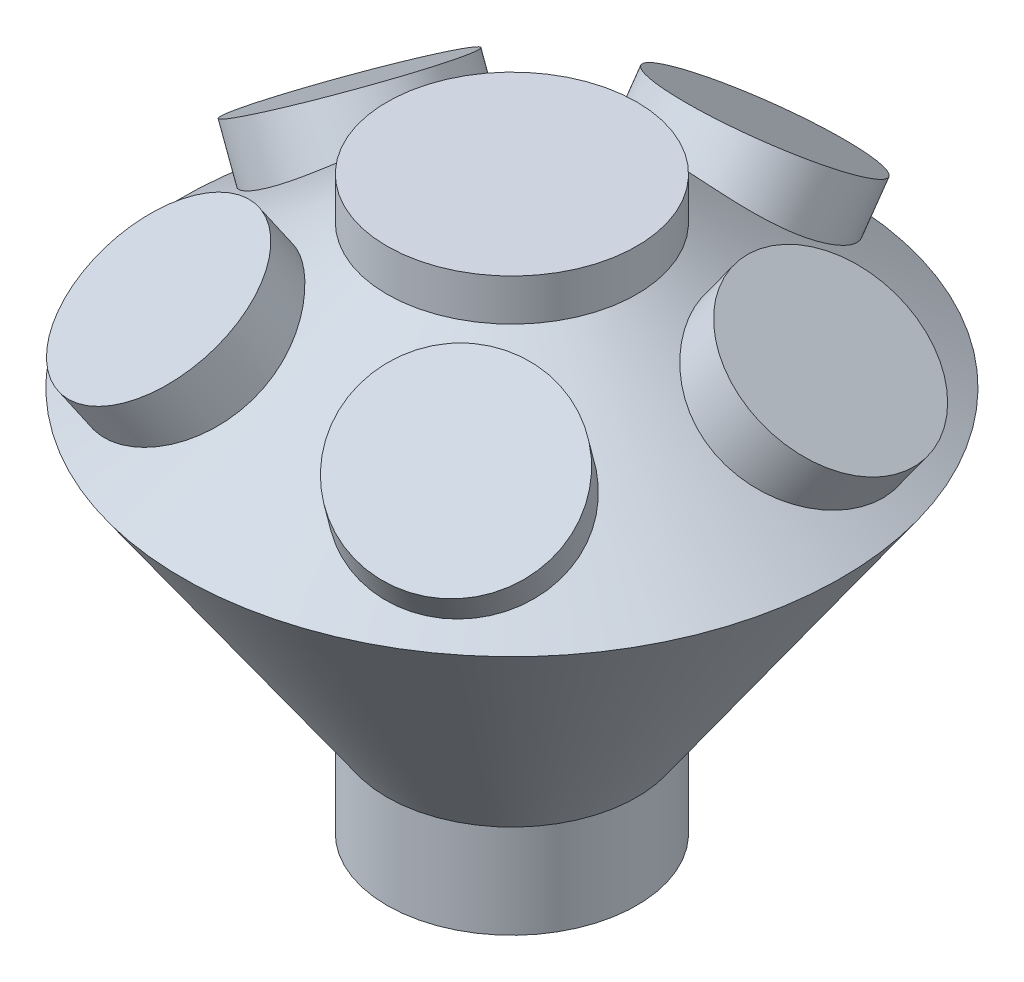
from build123d import *

# Parameters (mm, degrees)
F_7_16_0_4375_DIAMETER_HOLE1_D         = 11.1125
F_7_16_START                           = 1.779676233
F_7_16_0_4375_DIAMETER_HOLE2_OUTLINE_R = 5.55625
F_7_16_0_4375_DIAMETER_HOLE2_DEPTH     = 24.355951698
CIRPATTERN1_COUNT                      = 5
SKETCH11_R                             = 7.62
BOSS_EXTRUDE1_DEPTH                    = 2.54
BOSS_EXTRUDE2_START                    = 2.54
SKETCH12_R                             = 7.62
BOSS_EXTRUDE2_DEPTH                    = 2.54
BOSS_EXTRUDE3_REACH                    = 52.922
SKETCH13_R                             = 5.87375
SKETCH13_R_2                           = 5.55625
CUT_EXTRUDE1_START                     = -3.182233
SKETCH14_R                             = 5.55625
CUT_EXTRUDE1_DEPTH                     = 0.642233
CIRPATTERN3_COUNT                      = 5


# Read off the part's stored shape, not the designer's step: 7/16 (0.4375) Diameter Hole2
with BuildPart() as part:
    # Sketch1 → Revolve1 (revolve)
    with BuildSketch(Plane.XY, mode=Mode.PRIVATE) as revolve1_sk:
        Polygon((0, 0), (0, 26.570129165), (7.62, 26.570129165), (20.103877155, 17.828824275), (7.62, 0), (7.62, -3.175), (0, -3.175), align=None)
    revolve(revolve1_sk.sketch.rotate(Axis((0, 0, 0), (0, 1, 0)), 90), axis=Axis((0, 0, 0), (0, 1, 0)))

    # 7/16 (0.4375) Diameter Hole1 (through all)
    with Locations(Plane(origin=(0, 26.570129165, 0), x_dir=(1, 0, 0), z_dir=(0, 1, 0))):
        with Locations((0, 0)):
            Hole(F_7_16_0_4375_DIAMETER_HOLE1_D / 2)

    # 7/16 (0.4375) Diameter Hole2 outline → 7/16 (0.4375) Diameter Hole2 (cut)
    with BuildSketch(Plane(origin=(0, 0, 0), x_dir=(1, 0, 0), z_dir=(0, 0.8191520442889911, -0.5735764363510472)).offset(F_7_16_START)):
        with Locations((0, -1.246142784)):
            Circle(F_7_16_0_4375_DIAMETER_HOLE2_OUTLINE_R)
    f_7_16_0_4375_diameter_hole2 = extrude(amount=F_7_16_0_4375_DIAMETER_HOLE2_DEPTH, mode=Mode.SUBTRACT)

    # CirPattern1: 7/16 (0.4375) Diameter Hole2 ×5 about axis
    cirpattern1_axis = Axis((0, 26.570129165, 0), (0, 1, 0))
    for i in range(1, CIRPATTERN1_COUNT):
        add(f_7_16_0_4375_diameter_hole2.rotate(cirpattern1_axis, i * 360 / CIRPATTERN1_COUNT), mode=Mode.SUBTRACT)

    # Sketch11 → Boss-Extrude1 (add)
    with BuildSketch(Plane(origin=(0, 26.570129165, 0), x_dir=(1, 0, 0), z_dir=(0, 1, 0))):
        with Locations(Location((0, 0, 0), (0, 0, 90))):
            Circle(SKETCH11_R)
    extrude(amount=BOSS_EXTRUDE1_DEPTH)

    # Sketch12 → Boss-Extrude2 (add)
    with BuildSketch(Plane.XZ.offset(3.175).offset(BOSS_EXTRUDE2_START)):
        with Locations(Location((0, 0, 0), (0, 0, 270))):
            Circle(SKETCH12_R)
    extrude(amount=-BOSS_EXTRUDE2_DEPTH)

    # Boss-Extrude3: up to this cone (the profile starts outside it)
    boss_extrude3_end = Plane(origin=(0, 22.5675805, 0), z_dir=(0, -1, 0)).offset(-9.338129106) * Cone(1.428e-06, 111.014569628, 77.733237505, align=(Align.CENTER, Align.CENTER, Align.MIN), mode=Mode.PRIVATE)
    # Sketch13 → Boss-Extrude3 (add, up to the surface)
    with BuildSketch(Plane(origin=(0, 23.489699353, -16.447664557), x_dir=(1, 0, 0), z_dir=(0, 0.8191520442889909, -0.5735764363510475)), mode=Mode.PRIVATE) as boss_extrude3_sk1:
        with Locations(Location((0, -1.246142784, 0), (0, 0, 270))):
            Circle(SKETCH13_R)
        with Locations(Location((0, -1.246142784, 0), (0, 0, 306))):
            Circle(SKETCH13_R_2, mode=Mode.SUBTRACT)
    boss_extrude3_tool1 = extrude(boss_extrude3_sk1.sketch, amount=-BOSS_EXTRUDE3_REACH, mode=Mode.PRIVATE) - boss_extrude3_end
    # Sketch13 → Boss-Extrude3 (add, up to the surface)
    with BuildSketch(Plane(origin=(0, 23.489699353, -16.447664557), x_dir=(1, 0, 0), z_dir=(0, 0.8191520442889909, -0.5735764363510475)), mode=Mode.PRIVATE) as boss_extrude3_sk2:
        with Locations(Location((0, -1.246142784, 0), (0, 0, 306))):
            Circle(SKETCH13_R_2)
    boss_extrude3_tool2 = extrude(boss_extrude3_sk2.sketch, amount=-BOSS_EXTRUDE3_REACH, mode=Mode.PRIVATE) - boss_extrude3_end
    boss_extrude3 = boss_extrude3_tool1.solids().sort_by_distance((0, 20.930704, -20.102289))[0] + boss_extrude3_tool2.solids().sort_by_distance((0, 24.204457, -15.426884))[0]
    add(boss_extrude3)

    # Sketch14 → Cut-Extrude1 (cut)
    with BuildSketch(Plane(origin=(0, 23.489699353, -16.447664557), x_dir=(1, 0, 0), z_dir=(0, 0.8191520442889909, -0.5735764363510475)).offset(CUT_EXTRUDE1_START)):
        with Locations(Location((0, -1.246142784, 0), (0, 0, 270))):
            Circle(SKETCH14_R)
    cut_extrude1 = extrude(amount=CUT_EXTRUDE1_DEPTH, mode=Mode.SUBTRACT)

    # CirPattern3: Boss-Extrude3, Cut-Extrude1 ×5 about axis
    cirpattern3_axis = Axis((0, 0, 0), (0, 1, 0))
    add([boss_extrude3.rotate(cirpattern3_axis, i * 360 / CIRPATTERN3_COUNT) for i in range(1, CIRPATTERN3_COUNT)])
    add([cut_extrude1.rotate(cirpattern3_axis, i * 360 / CIRPATTERN3_COUNT) for i in range(1, CIRPATTERN3_COUNT)], mode=Mode.SUBTRACT)


solid = part.part
